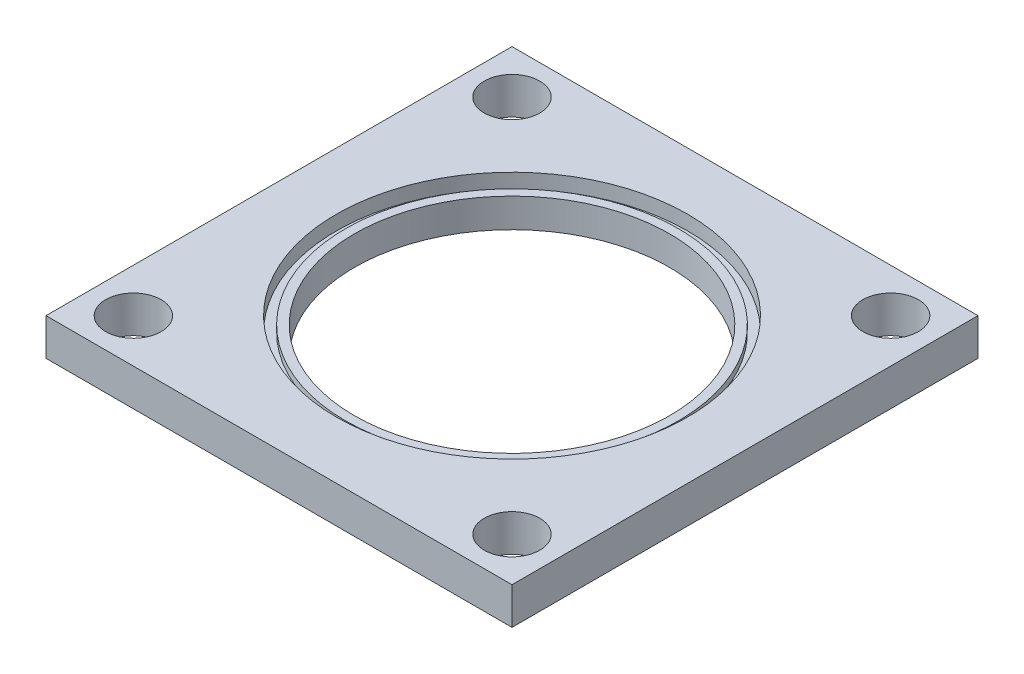
from build123d import *

# Parameters (mm, degrees)
PLATEOUTLINE_W      = 80
PLATEOUTLINE_H      = 80
BOSS_EXTRUDE1_DEPTH = 6.35
RAILGUIDES_R        = 4.7625
CUT_EXTRUDE1_DEPTH  = 10
CUT_EXTRUDE2_START  = 5
FUELGRAINMOUNTING_R = 30.1625
CUT_EXTRUDE2_DEPTH  = 5
GASINTAKE_R         = 27.051
CUT_EXTRUDE3_DEPTH  = 5
CUT_EXTRUDE4_START  = 3.857
SKETCH1_R           = 30.1625
SKETCH1_R_2         = 28.575
CUT_EXTRUDE4_DEPTH  = 1.143


with BuildPart() as part:
    # plateOutline → Boss-Extrude1 (new body)
    with BuildSketch(Plane(origin=(0, 0, 0), x_dir=(1, 0, 0), z_dir=(0, 1, 0))):
        Rectangle(PLATEOUTLINE_W, PLATEOUTLINE_H)
    extrude(amount=BOSS_EXTRUDE1_DEPTH)

    # railGuides → Cut-Extrude1 (cut)
    with BuildSketch(Plane(origin=(0, 0, 0), x_dir=(1, 0, 0), z_dir=(0, 1, 0))):
        with Locations((-32.5, 32.5)):
            Circle(RAILGUIDES_R)
        with Locations((32.5, 32.5)):
            Circle(RAILGUIDES_R)
        with Locations((32.5, -32.5)):
            Circle(RAILGUIDES_R)
        with Locations((-32.5, -32.5)):
            Circle(RAILGUIDES_R)
    extrude(amount=CUT_EXTRUDE1_DEPTH, mode=Mode.SUBTRACT)

    # FuelGrainMounting → Cut-Extrude2 (cut)
    with BuildSketch(Plane(origin=(0, 0, 0), x_dir=(1, 0, 0), z_dir=(0, 1, 0)).offset(CUT_EXTRUDE2_START)):
        Circle(FUELGRAINMOUNTING_R)
    extrude(amount=CUT_EXTRUDE2_DEPTH, mode=Mode.SUBTRACT)

    # GasIntake → Cut-Extrude3 (cut)
    with BuildSketch(Plane(origin=(0, 0, 0), x_dir=(1, 0, 0), z_dir=(0, 1, 0))):
        Circle(GASINTAKE_R)
    extrude(amount=CUT_EXTRUDE3_DEPTH, mode=Mode.SUBTRACT)

    # Sketch1 → Cut-Extrude4 (cut)
    with BuildSketch(Plane(origin=(0, 0, 0), x_dir=(1, 0, 0), z_dir=(0, 1, 0)).offset(CUT_EXTRUDE4_START)):
        Circle(SKETCH1_R)
        Circle(SKETCH1_R_2, mode=Mode.SUBTRACT)
    extrude(amount=CUT_EXTRUDE4_DEPTH, mode=Mode.SUBTRACT)


solid = part.part
